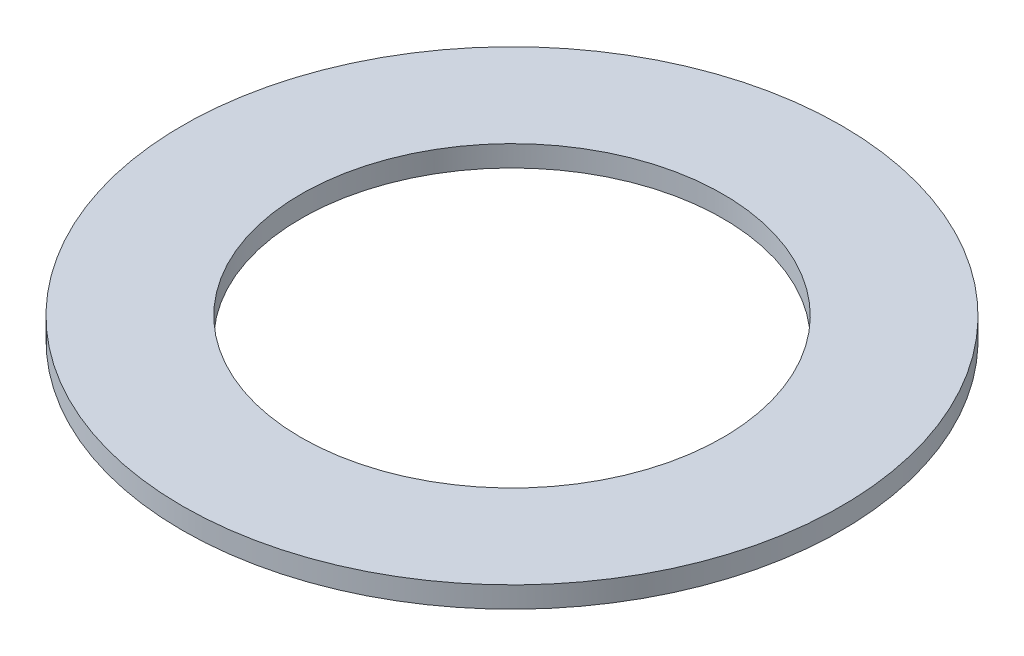
from build123d import *

# Parameters (mm, degrees)
SKETCH1_R           = 62.5
BOSS_EXTRUDE1_DEPTH = 4
SKETCH2_R           = 40
CUT_EXTRUDE1_DEPTH  = 89.478811023


with BuildPart() as part:
    # Sketch1 → Boss-Extrude1 (new body)
    with BuildSketch(Plane(origin=(0, 0, 0), x_dir=(1, 0, 0), z_dir=(0, 1, 0))):
        Circle(SKETCH1_R)
    extrude(amount=BOSS_EXTRUDE1_DEPTH)

    # Sketch2 → Cut-Extrude1 (cut, through all)
    with BuildSketch(Plane(origin=(0, 0, 0), x_dir=(1, 0, 0), z_dir=(0, 1, 0))):
        Circle(SKETCH2_R)
    extrude(amount=CUT_EXTRUDE1_DEPTH, mode=Mode.SUBTRACT)


solid = part.part
